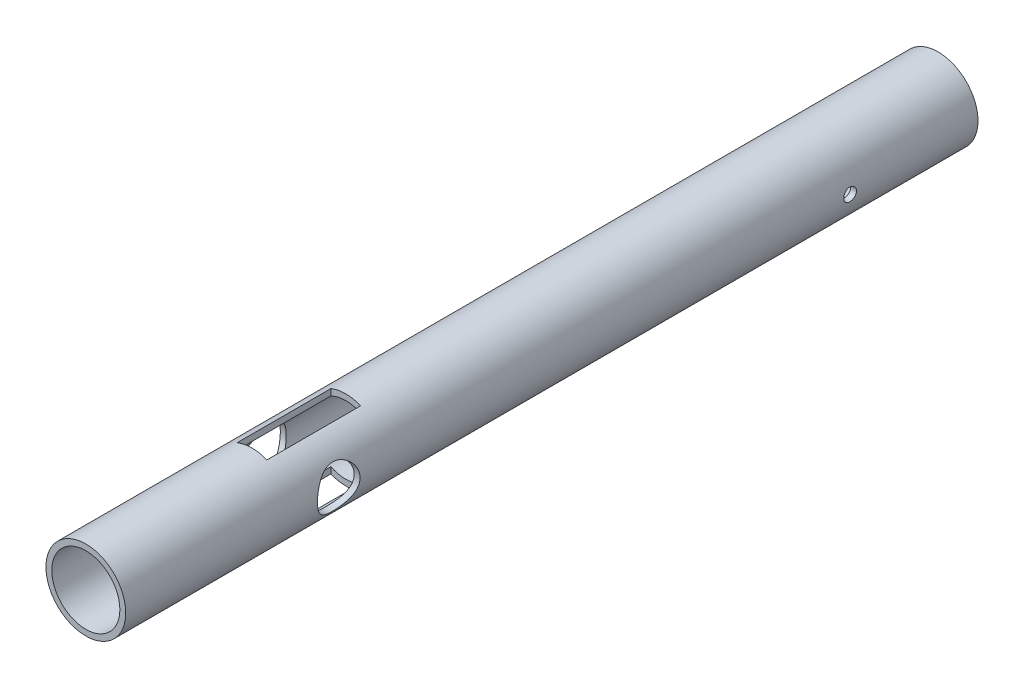
from build123d import *

# Parameters (mm, degrees)
SKETCH1_R           = 9.36
SKETCH1_R_2         = 7.99
EXTRUDE1_DEPTH      = 200
EXTRUDE2_DEPTH      = 201.437569333
EXTRUDE2_DEPTH_BACK = 201.437569333
SKETCH2_R           = 1.5
SKETCH2_R_2         = 5
EXTRUDE3_DEPTH      = 25
EXTRUDE3_DEPTH_BACK = 25
SKETCH3_W           = 7
SKETCH3_H           = 22


with BuildPart() as part:
    # Sketch1 → Extrude1 (new body)
    with BuildSketch(Plane.XY):
        Circle(SKETCH1_R)
        Circle(SKETCH1_R_2, mode=Mode.SUBTRACT)
    extrude(amount=EXTRUDE1_DEPTH)

    # Sketch2 → Extrude2 (cut, two sides: drawn at the far end of the back side and taken through both)
    with BuildSketch(Plane(origin=(0, 0, 0), x_dir=(0, 0, -1), z_dir=(1, 0, 0)).offset(-EXTRUDE2_DEPTH_BACK)):
        with Locations((-30, 0)):
            Circle(SKETCH2_R)
        with Locations((-150, 0)):
            Circle(SKETCH2_R_2)
    extrude(amount=EXTRUDE2_DEPTH + EXTRUDE2_DEPTH_BACK, mode=Mode.SUBTRACT)

    # Sketch3 → Extrude3 (cut, two sides: drawn at the far end of the back side and taken through both)
    with BuildSketch(Plane(origin=(0, 0, 0), x_dir=(1, 0, 0), z_dir=(0, 1, 0)).offset(-EXTRUDE3_DEPTH_BACK)):
        with Locations((0, -150)):
            Rectangle(SKETCH3_W, SKETCH3_H)
    extrude(amount=EXTRUDE3_DEPTH + EXTRUDE3_DEPTH_BACK, mode=Mode.SUBTRACT)


solid = part.part
